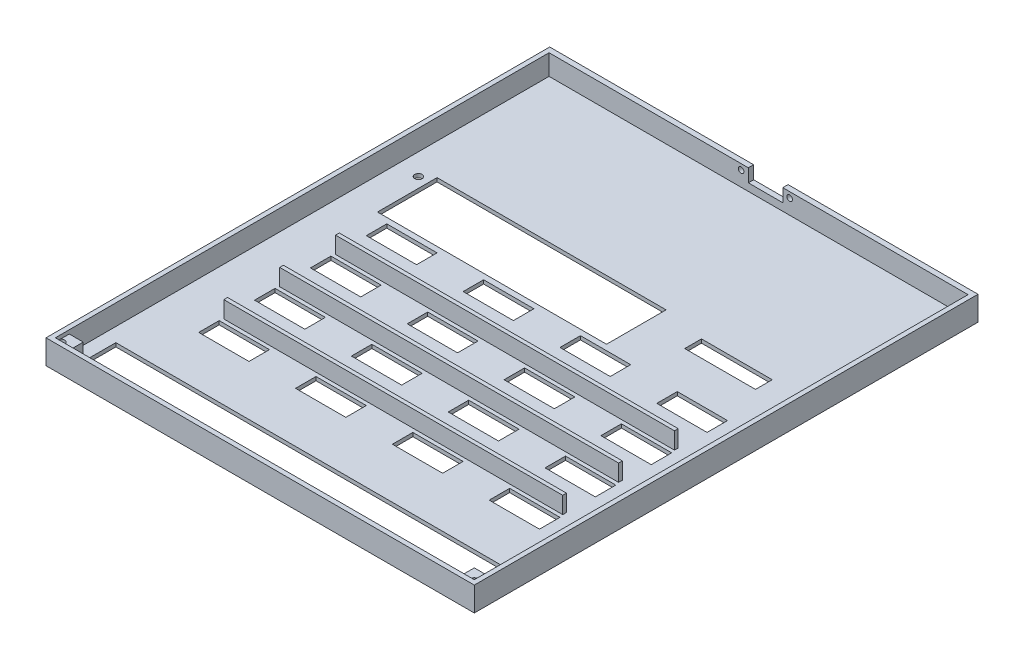
from build123d import *

# Parameters (mm, degrees)
ESQUISSE3_W              = 225
ESQUISSE3_H              = 190
ESQUISSE3_W_2            = 209.5
ESQUISSE3_H_2            = 20
ESQUISSE3_W_3            = 123
ESQUISSE3_H_3            = 30
BLOC_COQUE_DEPTH         = 16
ESQUISSE5_W              = 27
ESQUISSE5_H              = 11
TROU_CARTOUCHE_DEPTH     = 149.112288484
COQUE5_START             = -61
COQUE5_OUTLINE_W         = 13
COQUE5_OUTLINE_H         = 14
COQUE5_OUTLINE_W_2       = 21
COQUE5_DEPTH             = 129
COQUE5_START_2           = -93
COQUE5_2_OUTLINE_W       = 81
COQUE5_2_OUTLINE_H       = 14
COQUE5_2_OUTLINE_W_2     = 13
COQUE5_2_DEPTH           = 33
COQUE5_START_3           = 45
COQUE5_3_OUTLINE_W       = 31
COQUE5_3_OUTLINE_H       = 14
COQUE5_3_DEPTH           = 23
COQUE5_START_4           = -45
COQUE5_4_OUTLINE_W       = 31
COQUE5_4_OUTLINE_H       = 14
COQUE5_4_DEPTH           = 15
COQUE5_START_5           = -15
COQUE5_5_OUTLINE_W       = 31
COQUE5_5_OUTLINE_H       = 14
COQUE5_5_DEPTH           = 15
COQUE5_START_6           = 15
COQUE5_6_OUTLINE_W       = 31
COQUE5_6_OUTLINE_H       = 14
COQUE5_6_DEPTH           = 15
COQUE5_START_7           = 92
COQUE5_7_OUTLINE_W       = 221
COQUE5_7_OUTLINE_H       = 14
COQUE5_7_DEPTH           = 1
COQUE5_START_8           = 68
COQUE5_8_OUTLINE_W       = 4
COQUE5_8_OUTLINE_H       = 14
COQUE5_8_OUTLINE_W_2     = 3.5
COQUE5_8_DEPTH           = 24
COQUE5_9_OUTLINE_W       = 15
COQUE5_9_OUTLINE_H       = 14
COQUE5_9_OUTLINE_W_2     = 31
COQUE5_9_DEPTH           = 1
ESQUISSE6_W              = 138
ESQUISSE6_H              = 183.5
LOGEMENT_CARTE_DEPTH     = 6
ESQUISSE10_R             = 2
ENL_V_MAT_EXTRU_2_DEPTH  = 15
ESQUISSE12_W             = 100
ESQUISSE12_H             = 186
ENL_V_MAT_EXTRU_4_DEPTH  = 6
ESQUISSE13_W             = 123
ESQUISSE13_H             = 10
ENL_V_MAT_EXTRU_5_DEPTH  = 2
ESQUISSE14_W             = 200
ESQUISSE14_H             = 108.975087814
ENL_V_MAT_EXTRU_6_DEPTH  = 8
ESQUISSE16_W             = 38
ESQUISSE16_H             = 9
ENL_V_MAT_EXTRU_7_DEPTH  = 10
ESQUISSE17_W             = 230
ESQUISSE17_H             = 195
ESQUISSE17_W_2           = 225
ESQUISSE17_H_2           = 190
BOSS_EXTRU_2_DEPTH       = 13
ESQUISSE18_W             = 230
ESQUISSE18_H             = 4.5
ENL_V_MAT_EXTRU_8_DEPTH  = 152.328285525
ESQUISSE20_W             = 230
ESQUISSE20_H             = 80
BOSS_EXTRU_3_DEPTH       = 13
ESQUISSE21_W             = 225
ESQUISSE21_H             = 75.152232857
ENL_V_MAT_EXTRU_9_DEPTH  = 7
ESQUISSE25_W             = 18.5
ESQUISSE25_H             = 9.5
ENL_V_MAT_EXTRU_11_DEPTH = 10
ESQUISSE29_R             = 1.5
ENL_V_MAT_EXTRU_14_DEPTH = 6
ESQUISSE36_W             = 225.011669516
ESQUISSE36_H             = 265.152232857
ENL_V_MAT_EXTRU_18_DEPTH = 14
ESQUISSE30_W             = 10
ESQUISSE30_H             = 10
BOSS_EXTRU_4_DEPTH       = 11
ESQUISSE33_R             = 2
ENL_V_MAT_EXTRU_16_DEPTH = 209.026440627
ESQUISSE37_W             = 182
ESQUISSE37_H             = 2
BOSS_EXTRU_6_DEPTH       = 9


# Read off the part's stored shape, not the designer's step: Coque5
with BuildPart() as part:
    # Esquisse3 → Bloc coque (new body)
    with BuildSketch(Plane(origin=(0, 0, 0), x_dir=(1, 0, 0), z_dir=(0, 1, 0))):
        Rectangle(ESQUISSE3_W, ESQUISSE3_H)
        with Locations((-0.25, -80)):
            Rectangle(ESQUISSE3_W_2, ESQUISSE3_H_2, mode=Mode.SUBTRACT)
        with Locations((-34, 78)):
            Rectangle(ESQUISSE3_W_3, ESQUISSE3_H_3, mode=Mode.SUBTRACT)
    extrude(amount=BLOC_COQUE_DEPTH)

    # Esquisse5 → Trou cartouche (cut, through all)
    with BuildSketch(Plane(origin=(0, 16, 0), x_dir=(1, 0, 0), z_dir=(0, 1, 0))):
        with Locations((-74, 52.5)):
            Rectangle(ESQUISSE5_W, ESQUISSE5_H)
        with Locations((-22, 52.5)):
            Rectangle(ESQUISSE5_W, ESQUISSE5_H)
        with Locations((30, 52.5)):
            Rectangle(ESQUISSE5_W, ESQUISSE5_H)
        with Locations((82, 52.5)):
            Rectangle(ESQUISSE5_W, ESQUISSE5_H)
        with Locations((-22, 22.5)):
            Rectangle(ESQUISSE5_W, ESQUISSE5_H)
        with Locations((30, 22.5)):
            Rectangle(ESQUISSE5_W, ESQUISSE5_H)
        with Locations((82, 22.5)):
            Rectangle(ESQUISSE5_W, ESQUISSE5_H)
        with Locations((-22, -7.5)):
            Rectangle(ESQUISSE5_W, ESQUISSE5_H)
        with Locations((30, -7.5)):
            Rectangle(ESQUISSE5_W, ESQUISSE5_H)
        with Locations((82, -7.5)):
            Rectangle(ESQUISSE5_W, ESQUISSE5_H)
        with Locations((-22, -37.5)):
            Rectangle(ESQUISSE5_W, ESQUISSE5_H)
        with Locations((30, -37.5)):
            Rectangle(ESQUISSE5_W, ESQUISSE5_H)
        with Locations((82, -37.5)):
            Rectangle(ESQUISSE5_W, ESQUISSE5_H)
        with Locations((-74, 22.5)):
            Rectangle(ESQUISSE5_W, ESQUISSE5_H)
        with Locations((-74, -7.5)):
            Rectangle(ESQUISSE5_W, ESQUISSE5_H)
        with Locations((-74, -37.5)):
            Rectangle(ESQUISSE5_W, ESQUISSE5_H)
    extrude(amount=-TROU_CARTOUCHE_DEPTH, mode=Mode.SUBTRACT)

    # Coque5 outline → Coque5 (cut)
    with BuildSketch(Plane.XY.offset(COQUE5_START)):
        with Locations((104, 9)):
            Rectangle(COQUE5_OUTLINE_W, COQUE5_OUTLINE_H)
        with Locations((56, 9)):
            Rectangle(COQUE5_OUTLINE_W_2, COQUE5_OUTLINE_H)
        with Locations((4, 9)):
            Rectangle(COQUE5_OUTLINE_W_2, COQUE5_OUTLINE_H)
        with Locations((-48, 9)):
            Rectangle(COQUE5_OUTLINE_W_2, COQUE5_OUTLINE_H)
        with Locations((-100, 9)):
            Rectangle(COQUE5_OUTLINE_W_2, COQUE5_OUTLINE_H)
    extrude(amount=COQUE5_DEPTH, mode=Mode.SUBTRACT)

    # Coque5 2 outline → Coque5 2 (cut)
    with BuildSketch(Plane.XY.offset(COQUE5_START_2)):
        with Locations((70, 9)):
            Rectangle(COQUE5_2_OUTLINE_W, COQUE5_2_OUTLINE_H)
        with Locations((-104, 9)):
            Rectangle(COQUE5_2_OUTLINE_W_2, COQUE5_2_OUTLINE_H)
    extrude(amount=COQUE5_2_DEPTH, mode=Mode.SUBTRACT)

    # Coque5 3 outline → Coque5 3 (cut)
    with BuildSketch(Plane.XY.offset(COQUE5_START_3)):
        with Locations((82, 9)):
            Rectangle(COQUE5_3_OUTLINE_W, COQUE5_3_OUTLINE_H)
        with Locations((30, 9)):
            Rectangle(COQUE5_3_OUTLINE_W, COQUE5_3_OUTLINE_H)
        with Locations((-22, 9)):
            Rectangle(COQUE5_3_OUTLINE_W, COQUE5_3_OUTLINE_H)
        with Locations((-74, 9)):
            Rectangle(COQUE5_3_OUTLINE_W, COQUE5_3_OUTLINE_H)
    extrude(amount=COQUE5_3_DEPTH, mode=Mode.SUBTRACT)

    # Coque5 4 outline → Coque5 4 (cut)
    with BuildSketch(Plane.XY.offset(COQUE5_START_4)):
        with Locations((82, 9)):
            Rectangle(COQUE5_4_OUTLINE_W, COQUE5_4_OUTLINE_H)
        with Locations((30, 9)):
            Rectangle(COQUE5_4_OUTLINE_W, COQUE5_4_OUTLINE_H)
        with Locations((-22, 9)):
            Rectangle(COQUE5_4_OUTLINE_W, COQUE5_4_OUTLINE_H)
        with Locations((-74, 9)):
            Rectangle(COQUE5_4_OUTLINE_W, COQUE5_4_OUTLINE_H)
    extrude(amount=COQUE5_4_DEPTH, mode=Mode.SUBTRACT)

    # Coque5 5 outline → Coque5 5 (cut)
    with BuildSketch(Plane.XY.offset(COQUE5_START_5)):
        with Locations((82, 9)):
            Rectangle(COQUE5_5_OUTLINE_W, COQUE5_5_OUTLINE_H)
        with Locations((30, 9)):
            Rectangle(COQUE5_5_OUTLINE_W, COQUE5_5_OUTLINE_H)
        with Locations((-22, 9)):
            Rectangle(COQUE5_5_OUTLINE_W, COQUE5_5_OUTLINE_H)
        with Locations((-74, 9)):
            Rectangle(COQUE5_5_OUTLINE_W, COQUE5_5_OUTLINE_H)
    extrude(amount=COQUE5_5_DEPTH, mode=Mode.SUBTRACT)

    # Coque5 6 outline → Coque5 6 (cut)
    with BuildSketch(Plane.XY.offset(COQUE5_START_6)):
        with Locations((82, 9)):
            Rectangle(COQUE5_6_OUTLINE_W, COQUE5_6_OUTLINE_H)
        with Locations((30, 9)):
            Rectangle(COQUE5_6_OUTLINE_W, COQUE5_6_OUTLINE_H)
        with Locations((-22, 9)):
            Rectangle(COQUE5_6_OUTLINE_W, COQUE5_6_OUTLINE_H)
        with Locations((-74, 9)):
            Rectangle(COQUE5_6_OUTLINE_W, COQUE5_6_OUTLINE_H)
    extrude(amount=COQUE5_6_DEPTH, mode=Mode.SUBTRACT)

    # Coque5 7 outline → Coque5 7 (cut)
    with BuildSketch(Plane.XY.offset(COQUE5_START_7)):
        with Locations((0, 9)):
            Rectangle(COQUE5_7_OUTLINE_W, COQUE5_7_OUTLINE_H)
    extrude(amount=COQUE5_7_DEPTH, mode=Mode.SUBTRACT)

    # Coque5 8 outline → Coque5 8 (cut)
    with BuildSketch(Plane.XY.offset(COQUE5_START_8)):
        with Locations((108.5, 9)):
            Rectangle(COQUE5_8_OUTLINE_W, COQUE5_8_OUTLINE_H)
        with Locations((-108.75, 9)):
            Rectangle(COQUE5_8_OUTLINE_W_2, COQUE5_8_OUTLINE_H)
    extrude(amount=COQUE5_8_DEPTH, mode=Mode.SUBTRACT)

    # Coque5 9 outline → Coque5 9 (cut)
    with BuildSketch(Plane.XY.offset(COQUE5_START)):
        with Locations((22, 9)):
            Rectangle(COQUE5_9_OUTLINE_W, COQUE5_9_OUTLINE_H)
        with Locations((-22, 9)):
            Rectangle(COQUE5_9_OUTLINE_W_2, COQUE5_9_OUTLINE_H)
        with Locations((-74, 9)):
            Rectangle(COQUE5_9_OUTLINE_W_2, COQUE5_9_OUTLINE_H)
    extrude(amount=COQUE5_9_DEPTH, mode=Mode.SUBTRACT)

    # Esquisse6 → Logement carte (cut)
    with BuildSketch(Plane(origin=(0, 16, 0), x_dir=(1, 0, 0), z_dir=(0, 1, 0))):
        with Locations((-41.5, 1.25)):
            Rectangle(ESQUISSE6_W, ESQUISSE6_H)
    extrude(amount=-LOGEMENT_CARTE_DEPTH, mode=Mode.SUBTRACT)

    # Esquisse10 → Enlèv. mat.-Extru.2 (cut)
    with BuildSketch(Plane(origin=(0, 0, 0), x_dir=(-1, 0, 0), z_dir=(0, -1, 0))):
        with Locations(Location((-104, 88.5, 0), (0, 0, 90))):
            Circle(ESQUISSE10_R)
        with Locations(Location((101, 88.5, 0), (0, 0, 90))):
            Circle(ESQUISSE10_R)
        with Locations((-104, -84.5)):
            Circle(ESQUISSE10_R)
    extrude(amount=-ENL_V_MAT_EXTRU_2_DEPTH, mode=Mode.SUBTRACT)

    # Esquisse12 → Enlèv. mat.-Extru.4 (cut)
    with BuildSketch(Plane(origin=(0, 16, 0), x_dir=(1, 0, 0), z_dir=(0, 1, 0))):
        with Locations((60.5, 0)):
            Rectangle(ESQUISSE12_W, ESQUISSE12_H)
    extrude(amount=-ENL_V_MAT_EXTRU_4_DEPTH, mode=Mode.SUBTRACT)

    # Esquisse13 → Enlèv. mat.-Extru.5 (cut)
    with BuildSketch(Plane(origin=(0, 0, -63), x_dir=(-1, 0, 0), z_dir=(0, 0, -1))):
        with Locations((34, 5)):
            Rectangle(ESQUISSE13_W, ESQUISSE13_H)
    extrude(amount=-ENL_V_MAT_EXTRU_5_DEPTH, mode=Mode.SUBTRACT)

    # Esquisse14 → Enlèv. mat.-Extru.6 (cut)
    with BuildSketch(Plane(origin=(0, 10, 0), x_dir=(1, 0, 0), z_dir=(0, 1, 0))):
        with Locations((4.5, 6.512456093)):
            Rectangle(ESQUISSE14_W, ESQUISSE14_H)
    extrude(amount=-ENL_V_MAT_EXTRU_6_DEPTH, mode=Mode.SUBTRACT)

    # Esquisse16 → Enlèv. mat.-Extru.7 (cut)
    with BuildSketch(Plane.XZ):
        with Locations((69.5, -84.5)):
            Rectangle(ESQUISSE16_W, ESQUISSE16_H)
    extrude(amount=-ENL_V_MAT_EXTRU_7_DEPTH, mode=Mode.SUBTRACT)


with BuildPart() as body_2:
    # Esquisse17 → Boss.-Extru.2 (new body)
    with BuildSketch(Plane.XZ):
        Rectangle(ESQUISSE17_W, ESQUISSE17_H)
        Rectangle(ESQUISSE17_W_2, ESQUISSE17_H_2, mode=Mode.SUBTRACT)
    extrude(amount=-BOSS_EXTRU_2_DEPTH)


with BuildPart() as enl_v_mat_extru_8_tool:
    # Esquisse18 → Enlèv. mat.-Extru.8 (new, through all)
    with BuildSketch(Plane(origin=(0, 13, 0), x_dir=(1, 0, 0), z_dir=(0, 1, 0))):
        with Locations((0, 95.25)):
            Rectangle(ESQUISSE18_W, ESQUISSE18_H)
    extrude(amount=-ENL_V_MAT_EXTRU_8_DEPTH)


with BuildPart() as part_1:
    add(part.part)

    # Enlèv. mat.-Extru.8: cut by enl_v_mat_extru_8_tool
    add(enl_v_mat_extru_8_tool.part, mode=Mode.SUBTRACT)



with BuildPart() as body_2_1:
    add(body_2.part)

    # Enlèv. mat.-Extru.8: cut by enl_v_mat_extru_8_tool
    add(enl_v_mat_extru_8_tool.part, mode=Mode.SUBTRACT)


with BuildPart() as part_2:
    add(part_1.part)

    add(body_2_1.part)  # Boss.-Extru.3 merges body 2
    # Esquisse20 → Boss.-Extru.3 (add)
    with BuildSketch(Plane.XZ):
        with Locations((0, -133)):
            Rectangle(ESQUISSE20_W, ESQUISSE20_H)
    extrude(amount=-BOSS_EXTRU_3_DEPTH)

    # Esquisse21 → Enlèv. mat.-Extru.9 (cut)
    with BuildSketch(Plane(origin=(0, 13, 0), x_dir=(1, 0, 0), z_dir=(0, 1, 0))):
        with Locations((0, 132.576116429)):
            Rectangle(ESQUISSE21_W, ESQUISSE21_H)
    extrude(amount=-ENL_V_MAT_EXTRU_9_DEPTH, mode=Mode.SUBTRACT)

    # Esquisse25 → Enlèv. mat.-Extru.11 (cut)
    with BuildSketch(Plane(origin=(0, 0, -173), x_dir=(-1, 0, 0), z_dir=(0, 0, -1))):
        with Locations((-3.75, 10.75)):
            Rectangle(ESQUISSE25_W, ESQUISSE25_H)
    extrude(amount=-ENL_V_MAT_EXTRU_11_DEPTH, mode=Mode.SUBTRACT)

    # Esquisse29 → Enlèv. mat.-Extru.14 (cut)
    with BuildSketch(Plane.XY.offset(-170.152232857)):
        with Locations((16.689639813, 10)):
            Circle(ESQUISSE29_R)
        with Locations((-9.392025581, 10)):
            Circle(ESQUISSE29_R)
    extrude(amount=-ENL_V_MAT_EXTRU_14_DEPTH, mode=Mode.SUBTRACT)

    # Esquisse36 → Enlèv. mat.-Extru.18 (cut)
    with BuildSketch(Plane(origin=(0, 16, 0), x_dir=(1, 0, 0), z_dir=(0, 1, 0))):
        with Locations((0.005834758, 37.576116429)):
            Rectangle(ESQUISSE36_W, ESQUISSE36_H)
    extrude(amount=-ENL_V_MAT_EXTRU_18_DEPTH, mode=Mode.SUBTRACT)

    # Esquisse30 → Boss.-Extru.4 (add)
    with BuildSketch(Plane.XZ):
        with Locations((110, 92.5)):
            Rectangle(ESQUISSE30_W, ESQUISSE30_H)
        with Locations((-110, 92.5)):
            Rectangle(ESQUISSE30_W, ESQUISSE30_H)
    extrude(amount=-BOSS_EXTRU_4_DEPTH)

    # Esquisse33 → Enlèv. mat.-Extru.16 (cut, through all)
    with BuildSketch(Plane(origin=(0, 11, 0), x_dir=(1, 0, 0), z_dir=(0, 1, 0))):
        with Locations(Location((-111, -93.5, 0), (0, 0, 270))):
            Circle(ESQUISSE33_R)
        with Locations(Location((111, -93.5, 0), (0, 0, 311.409622109))):
            Circle(ESQUISSE33_R)
    extrude(amount=-ENL_V_MAT_EXTRU_16_DEPTH, mode=Mode.SUBTRACT)

    # Esquisse37 → Boss.-Extru.6 (add)
    with BuildSketch(Plane(origin=(0, 2, 0), x_dir=(1, 0, 0), z_dir=(0, 1, 0))):
        with Locations((4, -29)):
            Rectangle(ESQUISSE37_W, ESQUISSE37_H)
        with Locations((4, 1)):
            Rectangle(ESQUISSE37_W, ESQUISSE37_H)
        with Locations((4, 31)):
            Rectangle(ESQUISSE37_W, ESQUISSE37_H)
    extrude(amount=BOSS_EXTRU_6_DEPTH)


solid = part_2.part
